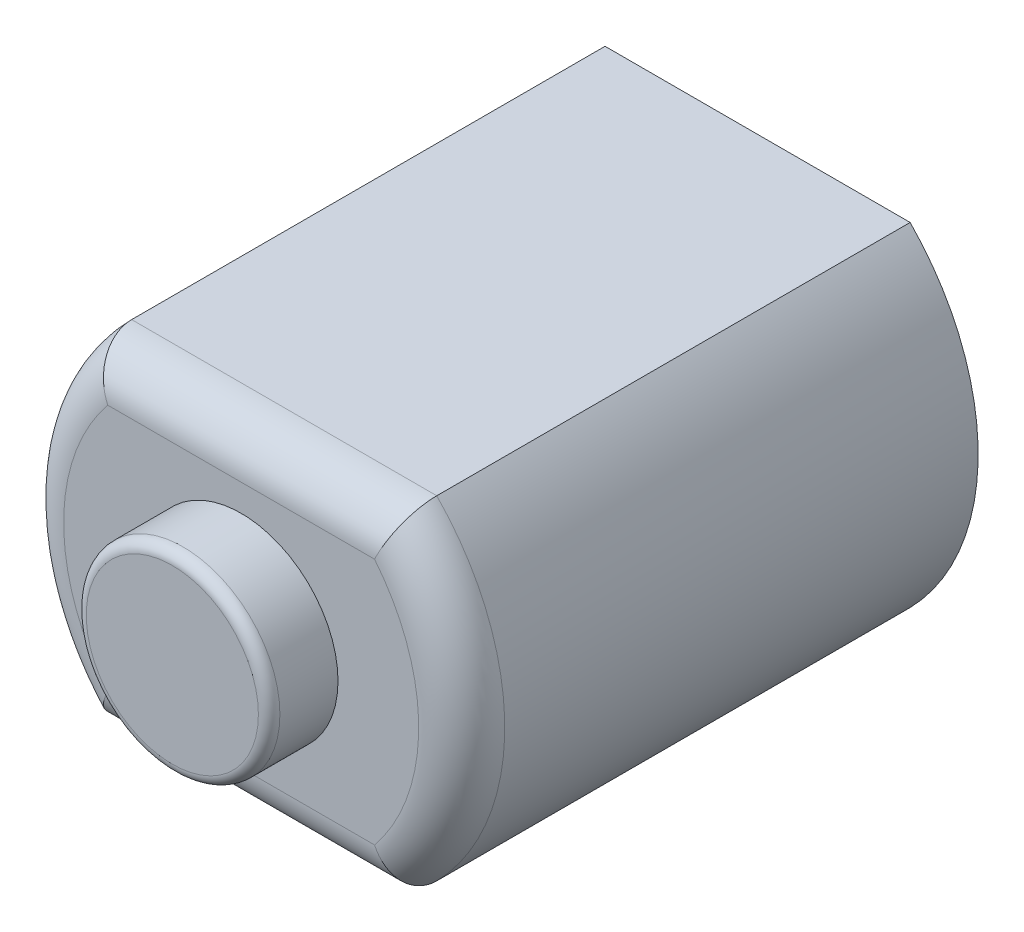
from build123d import *

# Parameters (mm, degrees)
SALIENTE_EXTRUIR1_DEPTH = 24
REDONDEO1_R             = 2
CROQUIS2_R              = 4.5
SALIENTE_EXTRUIR2_DEPTH = 3.2
REDONDEO2_R             = 0.5


with BuildPart() as part:
    # Croquis1 → Saliente-Extruir1 (new body)
    with BuildSketch(Plane.XY):
        with BuildLine():
            Line((7.09, 7.75), (-7.09, 7.75))
            ThreePointArc((-7.09, 7.75), (-10.25, 0), (-7.09, -7.75))
            Line((-7.09, -7.75), (7.09, -7.75))
            ThreePointArc((7.09, -7.75), (10.25, 0), (7.09, 7.75))
        make_face()
    extrude(amount=SALIENTE_EXTRUIR1_DEPTH)

    # Redondeo1
    redondeo1_edges = [part.edges().sort_by_distance(p)[0] for p in [
        (0, 7.75, 24),
        (10.25, 0, 24),
        (0, -7.75, 24),
        (-10.25, 0, 24),
    ]]
    fillet(redondeo1_edges, radius=REDONDEO1_R)

    # Croquis2 → Saliente-Extruir2 (add)
    with BuildSketch(Plane.XY.offset(24)):
        Circle(CROQUIS2_R)
    extrude(amount=SALIENTE_EXTRUIR2_DEPTH)

    # Redondeo2
    redondeo2_edges = [part.edges().sort_by_distance(p)[0] for p in [
        (-4.5, 0, 27.2),
    ]]
    fillet(redondeo2_edges, radius=REDONDEO2_R)


solid = part.part
